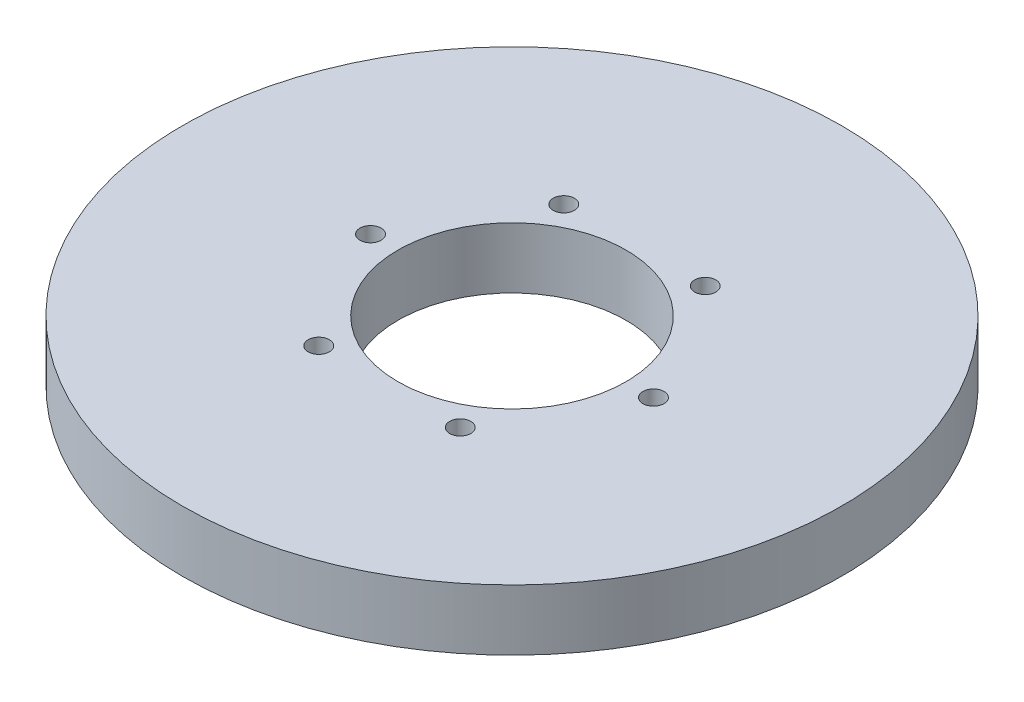
from build123d import *

# Parameters (mm, degrees)
SKETCH1_R           = 65
BOSS_EXTRUDE1_DEPTH = 12
SKETCH2_R           = 22.5
CUT_EXTRUDE1_DEPTH  = 93.703829479
SKETCH3_R           = 2.087130351
CUT_EXTRUDE2_DEPTH  = 11.260109142
CIRPATTERN1_COUNT   = 6


with BuildPart() as part:
    # Sketch1 → Boss-Extrude1 (new body)
    with BuildSketch(Plane(origin=(0, 0, 0), x_dir=(1, 0, 0), z_dir=(0, 1, 0))):
        Circle(SKETCH1_R)
    extrude(amount=BOSS_EXTRUDE1_DEPTH)

    # Sketch2 → Cut-Extrude1 (cut, through all)
    with BuildSketch(Plane(origin=(0, 0, 0), x_dir=(1, 0, 0), z_dir=(0, 1, 0))):
        Circle(SKETCH2_R)
    extrude(amount=CUT_EXTRUDE1_DEPTH, mode=Mode.SUBTRACT)

    # Sketch3 → Cut-Extrude2 (cut)
    with BuildSketch(Plane(origin=(0, 12, 0), x_dir=(1, 0, 0), z_dir=(0, 1, 0))):
        with Locations((-27.902014054, 0)):
            Circle(SKETCH3_R)
    cut_extrude2 = extrude(amount=-CUT_EXTRUDE2_DEPTH, mode=Mode.SUBTRACT)

    # CirPattern1: Cut-Extrude2 ×6 about axis
    cirpattern1_axis = Axis((0, 0, 0), (0, 1, 0))
    for i in range(1, CIRPATTERN1_COUNT):
        add(cut_extrude2.rotate(cirpattern1_axis, i * 360 / CIRPATTERN1_COUNT), mode=Mode.SUBTRACT)


solid = part.part
